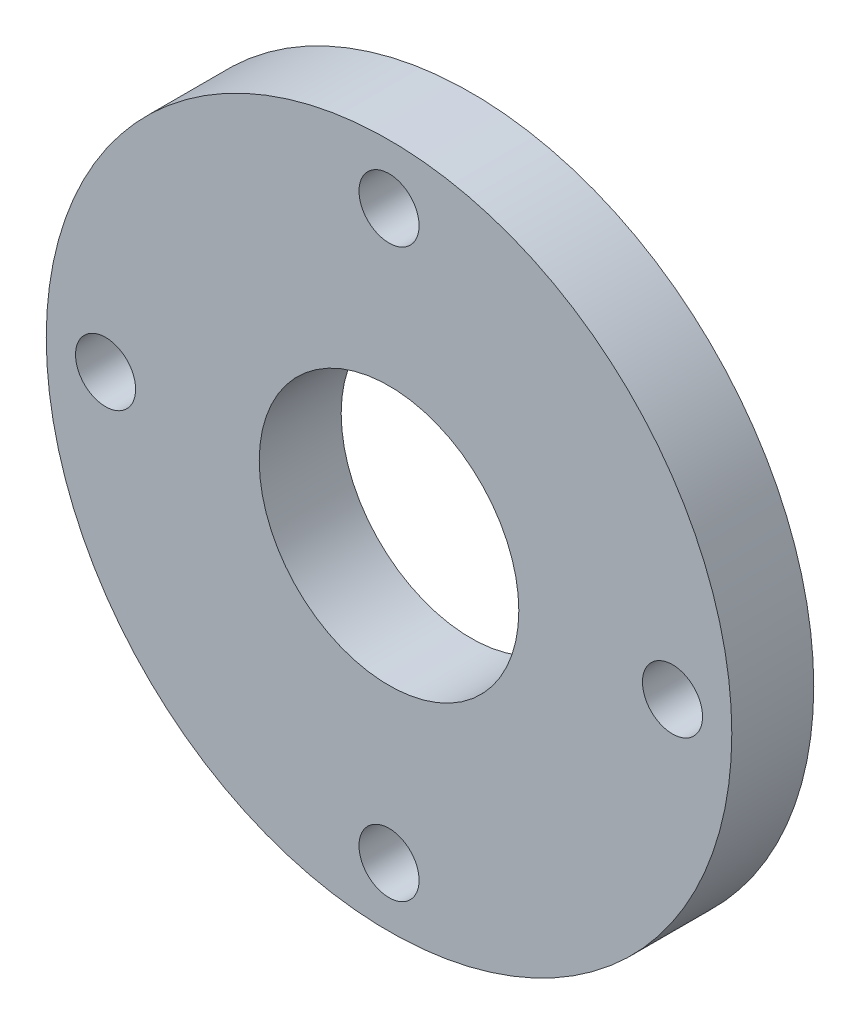
from build123d import *

# Parameters (mm, degrees)
SKETCH1_W            = 9.000000034
SKETCH1_H            = 28.14914995
SKETCH5_R            = 14.25575
SEAL_SEAT_DEPTH      = 54.999231402
M6_CLEARANCE_HOLE1_D = 6.6
CIRPATTERN1_COUNT    = 4


with BuildPart() as part:
    # Sketch1 → Main_body (revolve)
    with BuildSketch(Plane(origin=(0, 0, 0), x_dir=(0, 0, -1), z_dir=(1, 0, 0))):
        with Locations((-135.784000212, 23.574575025)):
            Rectangle(SKETCH1_W, SKETCH1_H)
    revolve(axis=Axis((0, 0, 1000), (0, 0, -1)))

    # Sketch5 → seal_seat (cut, through all)
    with BuildSketch(Plane.XY.offset(140.284000229)):
        Circle(SKETCH5_R)
    extrude(amount=-SEAL_SEAT_DEPTH, mode=Mode.SUBTRACT)

    # M6 Clearance Hole1 (through all)
    with Locations(Plane.XY.offset(140.284000229)):
        with Locations((0, 31.133925032)):
            m6_clearance_hole1 = Hole(M6_CLEARANCE_HOLE1_D / 2)

    # CirPattern1: M6 Clearance Hole1 ×4 about axis
    cirpattern1_axis = Axis((0, 0, 1000), (0, 0, -1))
    for i in range(1, CIRPATTERN1_COUNT):
        add(m6_clearance_hole1.rotate(cirpattern1_axis, i * 360 / CIRPATTERN1_COUNT), mode=Mode.SUBTRACT)


solid = part.part
